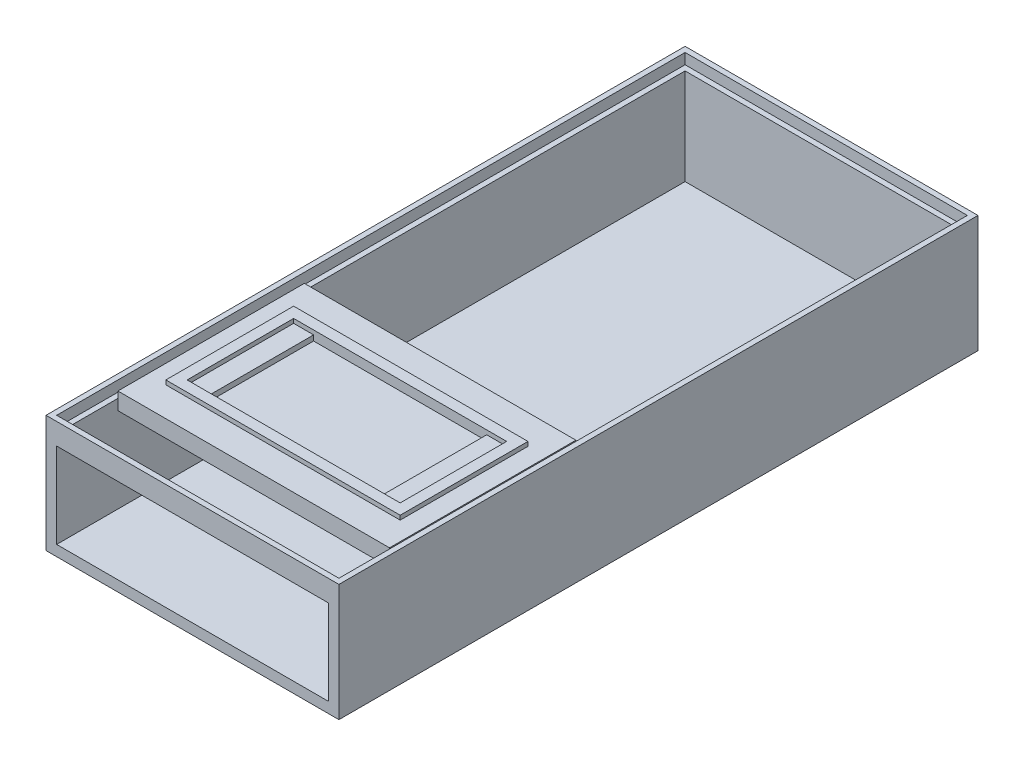
from build123d import *

# Parameters (mm, degrees)
SKETCH1_W            = 139.7
SKETCH1_H            = 304.8
BOSS_EXTRUDE1_DEPTH  = 5.08
SKETCH2_W            = 139.7
SKETCH2_H            = 304.8
SKETCH2_W_2          = 129.54
SKETCH2_H_2          = 294.64
WALLS_DEPTH          = 50.8
SKETCH3_W            = 134.62
SKETCH3_H            = 299.72
SKETCH3_W_2          = 129.54
SKETCH3_H_2          = 294.64
CUT_EXTRUDE1_DEPTH   = 5.08
SKETCH5_W            = 129.54
SKETCH5_H            = 88.9
BUTTON_SUPPORT_DEPTH = 48.768
SKETCH6_W            = 111.76
SKETCH6_H            = 60.96
SKETCH6_W_2          = 101.6
SKETCH6_H_2          = 50.8
BOSS_EXTRUDE4_DEPTH  = 2.032
SKETCH7_W            = 82.55
SKETCH7_H            = 50.8
CUT_EXTRUDE2_DEPTH   = 2.54
SKETCH4_W            = 129.54
SKETCH4_H            = 40.64
CUT_EXTRUDE3_DEPTH   = 139.7


with BuildPart() as part:
    # Sketch1 → Boss-Extrude1 (new body)
    with BuildSketch(Plane(origin=(0, 0, 0), x_dir=(1, 0, 0), z_dir=(0, 1, 0))):
        with Locations((69.85, 152.4)):
            Rectangle(SKETCH1_W, SKETCH1_H)
    extrude(amount=BOSS_EXTRUDE1_DEPTH)

    # Sketch2 → Walls (add)
    with BuildSketch(Plane(origin=(0, 5.08, 0), x_dir=(1, 0, 0), z_dir=(0, 1, 0))):
        with Locations((69.85, 152.4)):
            Rectangle(SKETCH2_W, SKETCH2_H)
        with Locations((69.85, 152.4)):
            Rectangle(SKETCH2_W_2, SKETCH2_H_2, mode=Mode.SUBTRACT)
    extrude(amount=WALLS_DEPTH)

    # Sketch3 → Cut-Extrude1 (cut)
    with BuildSketch(Plane(origin=(0, 55.88, 0), x_dir=(1, 0, 0), z_dir=(0, 1, 0))):
        with Locations((69.85, 152.4)):
            Rectangle(SKETCH3_W, SKETCH3_H)
        with Locations((69.85, 152.4)):
            Rectangle(SKETCH3_W_2, SKETCH3_H_2, mode=Mode.SUBTRACT)
    extrude(amount=-CUT_EXTRUDE1_DEPTH, mode=Mode.SUBTRACT)

    # Sketch5 → Button Support (add)
    with BuildSketch(Plane(origin=(0, 5.08, 0), x_dir=(1, 0, 0), z_dir=(0, 1, 0))):
        with Locations((69.85, 73.66)):
            Rectangle(SKETCH5_W, SKETCH5_H)
    extrude(amount=BUTTON_SUPPORT_DEPTH)

    # Sketch6 → Boss-Extrude4 (add)
    with BuildSketch(Plane(origin=(0, 53.848, 0), x_dir=(1, 0, 0), z_dir=(0, 1, 0))):
        with Locations((69.85, 73.66)):
            Rectangle(SKETCH6_W, SKETCH6_H)
        with Locations((69.85, 73.66)):
            Rectangle(SKETCH6_W_2, SKETCH6_H_2, mode=Mode.SUBTRACT)
    extrude(amount=BOSS_EXTRUDE4_DEPTH)

    # Sketch7 → Cut-Extrude2 (cut)
    with BuildSketch(Plane(origin=(0, 53.848, 0), x_dir=(1, 0, 0), z_dir=(0, 1, 0))):
        with Locations((69.85, 73.66)):
            Rectangle(SKETCH7_W, SKETCH7_H)
    extrude(amount=-CUT_EXTRUDE2_DEPTH, mode=Mode.SUBTRACT)

    # Sketch4 → Cut-Extrude3 (cut)
    with BuildSketch(Plane.XY):
        with Locations((69.85, 25.4)):
            Rectangle(SKETCH4_W, SKETCH4_H)
    extrude(amount=-CUT_EXTRUDE3_DEPTH, mode=Mode.SUBTRACT)


solid = part.part
